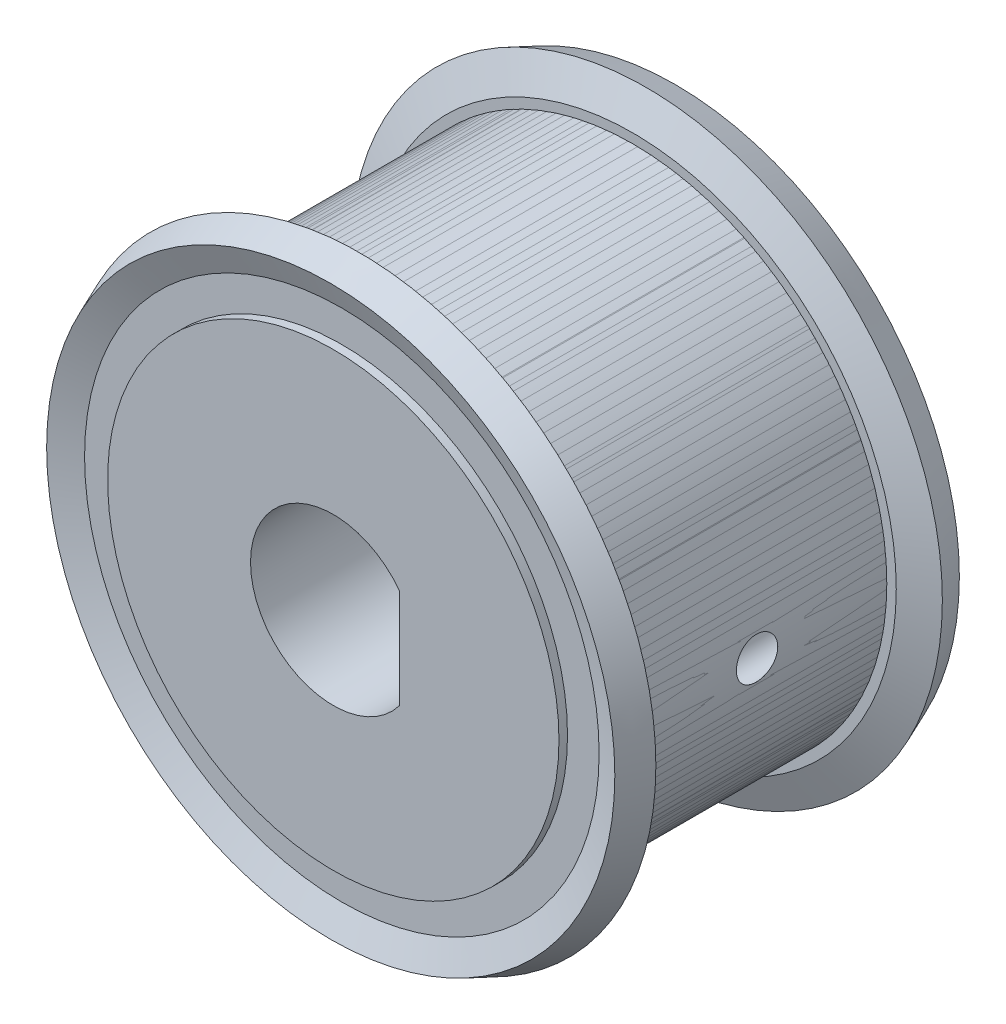
from build123d import *

# Parameters (mm, degrees)
TOOTHEXTRUDECUTGEARBELT01_DEPTH = 7.835899882
PATTERNGEARBELT01_COUNT         = 20
CUT_EXTRUDE_2_DEPTH             = 33.653112707
CUT_EXTRUDE_2_DEPTH_BACK        = 33.653112707
SKETCH_9_W                      = 1.25
SKETCH_9_H                      = 13.883987331


with BuildPart() as part:
    # SketchRevolveGearBelt01 → GearBelt01 (revolve)
    with BuildSketch(Plane(origin=(0, 0, 0), x_dir=(0, 0, -1), z_dir=(1, 0, 0))):
        Polygon((10.248899846, 0), (10.248899846, 13.629487395), (9.733279854, 13.629487395), (9.733279854, 15.538075019), (10.404229789, 17.157891451), (8.651279268, 17.883987331), (7.835899882, 15.915487361), (7.835899882, 15.34398737), (-7.835899882, 15.34398737), (-7.835899882, 15.915487361), (-8.651279268, 17.883987331), (-10.404229789, 17.157891451), (-9.733279854, 15.538075019), (-9.733279854, 13.629487395), (-10.248899846, 13.629487395), (-10.248899846, 0), align=None)
    revolve(axis=Axis((0, 0, 0), (0, 0, -1)))

    # SketchToothGearBelt01 → ToothExtrudeCutGearBelt01 (cut, symmetric)
    with BuildSketch(Plane.XY):
        with BuildLine():
            ThreePointArc((15.189205, 2.169993229), (15.343429185, 0), (15.189205, -2.169993229))
            add(Edge.make_bspline(
                [(15.189205, -2.169993229), (15.193305534, -2.141313845), (15.195757164, -2.097767751), (15.191587416, -2.039923228), (15.184765217, -1.996965665), (15.174297611, -1.954748066), (15.160261262, -1.913579187), (15.14275879, -1.873760103), (15.121918204, -1.835582022), (15.097891913, -1.79932415), (15.070855629, -1.76525165), (15.041007075, -1.733613699), (15.008564541, -1.704641692), (14.973765287, -1.678547436), (14.936863807, -1.655522038), (14.898129981, -1.635732867), (14.85784704, -1.619328456), (14.81630973, -1.606414559), (14.773821272, -1.597138675), (14.730694457, -1.591370625), (14.673606872, -1.58942772), (14.597833368, -1.590802706), (14.50329241, -1.587292017), (14.404301405, -1.575300386), (14.30654119, -1.555720458), (14.210619671, -1.528503959), (14.117125097, -1.493863505), (14.026633028, -1.452000056), (13.939699952, -1.403174359), (13.856860629, -1.347685871), (13.778624594, -1.285876137), (13.705473083, -1.218125284), (13.637856039, -1.144850065), (13.576189416, -1.066501192), (13.520852365, -0.98356059), (13.472185868, -0.896538423), (13.430487022, -0.805969981), (13.396020714, -0.71241229), (13.368967603, -0.616441044), (13.34961107, -0.518645741), (13.337633617, -0.419630986), (13.334152945, -0.299855766), (13.335612406, -0.160003622), (13.335055896, 0), (13.335612406, 0.160003622), (13.334152945, 0.299855766), (13.337633617, 0.419630986), (13.34961107, 0.518645741), (13.368967603, 0.616441044), (13.396020714, 0.71241229), (13.430487022, 0.805969981), (13.472185868, 0.896538423), (13.520852365, 0.98356059), (13.576189416, 1.066501192), (13.637856039, 1.144850065), (13.705473083, 1.218125284), (13.778624594, 1.285876137), (13.856860629, 1.347685871), (13.939699952, 1.403174359), (14.026633028, 1.452000056), (14.117125097, 1.493863505), (14.210619671, 1.528503959), (14.30654119, 1.555720458), (14.404301405, 1.575300386), (14.50329241, 1.587292017), (14.597833368, 1.590802706), (14.673606872, 1.58942772), (14.730694457, 1.591370625), (14.773821272, 1.597138675), (14.81630973, 1.606414559), (14.85784704, 1.619328456), (14.898129981, 1.635732867), (14.936863807, 1.655522038), (14.973765287, 1.678547436), (15.008564541, 1.704641692), (15.041007075, 1.733613699), (15.070855629, 1.76525165), (15.097891913, 1.79932415), (15.121918204, 1.835582022), (15.14275879, 1.873760103), (15.160261262, 1.913579187), (15.174297611, 1.954748066), (15.184765217, 1.996965665), (15.191587416, 2.039923228), (15.195757164, 2.097767751), (15.193305534, 2.141313845), (15.189205, 2.169993229)],
                knots=[0, 0, 0, 0, 0.013304592, 0.019956888, 0.026609185, 0.033261481, 0.039913777, 0.046566073, 0.053218369, 0.059870665, 0.066522961, 0.073175258, 0.079827554, 0.08647985, 0.093132146, 0.099784442, 0.106436738, 0.113089034, 0.11974133, 0.126393627, 0.133045923, 0.145957551, 0.161209637, 0.176461722, 0.191713808, 0.206965894, 0.222217979, 0.237470065, 0.252722151, 0.267974236, 0.283226322, 0.298478408, 0.313730493, 0.328982579, 0.344234665, 0.35948675, 0.374738836, 0.389990922, 0.405243007, 0.420495093, 0.435747179, 0.450999264, 0.475499632, 0.5, 0.524500368, 0.549000736, 0.564252821, 0.579504907, 0.594756993, 0.610009078, 0.625261164, 0.64051325, 0.655765335, 0.671017421, 0.686269507, 0.701521592, 0.716773678, 0.732025764, 0.747277849, 0.762529935, 0.777782021, 0.793034106, 0.808286192, 0.823538278, 0.838790363, 0.854042449, 0.866954077, 0.873606373, 0.88025867, 0.886910966, 0.893563262, 0.900215558, 0.906867854, 0.91352015, 0.920172446, 0.926824742, 0.933477039, 0.940129335, 0.946781631, 0.953433927, 0.960086223, 0.966738519, 0.973390815, 0.980043112, 0.986695408, 1, 1, 1, 1], degree=3))
        make_face()
    toothextrudecutgearbelt01 = extrude(amount=TOOTHEXTRUDECUTGEARBELT01_DEPTH, both=True, mode=Mode.SUBTRACT)

    # PatternGearBelt01: ToothExtrudeCutGearBelt01 ×20 about axis
    patterngearbelt01_axis = Axis((0, 0, 55), (0, 0, -1))
    for i in range(1, PATTERNGEARBELT01_COUNT):
        add(toothextrudecutgearbelt01.rotate(patterngearbelt01_axis, i * 360 / PATTERNGEARBELT01_COUNT), mode=Mode.SUBTRACT)

    # 草图5 → 切除-拉伸2 (cut, two sides: drawn at the far end of the back side and taken through both)
    with BuildSketch(Plane.XY.offset(10.248899846).offset(-CUT_EXTRUDE_2_DEPTH_BACK)):
        with BuildLine():
            Line((4, -3), (4, 3))
            ThreePointArc((4, 3), (-5, 0), (4, -3))
        make_face()
    extrude(amount=CUT_EXTRUDE_2_DEPTH + CUT_EXTRUDE_2_DEPTH_BACK, mode=Mode.SUBTRACT)

    # 草图9 → M3 螺纹孔1 (revolve, cut)
    with BuildSketch(Plane(origin=(4, 0, 0), x_dir=(0, 0, 1), z_dir=(0, 1, 0))):
        with Locations((0.625, 6.941993666)):
            Rectangle(SKETCH_9_W, SKETCH_9_H)
    revolve(axis=Axis((-2.35, 0, 0), (1, 0, 0)), mode=Mode.SUBTRACT)


solid = part.part
